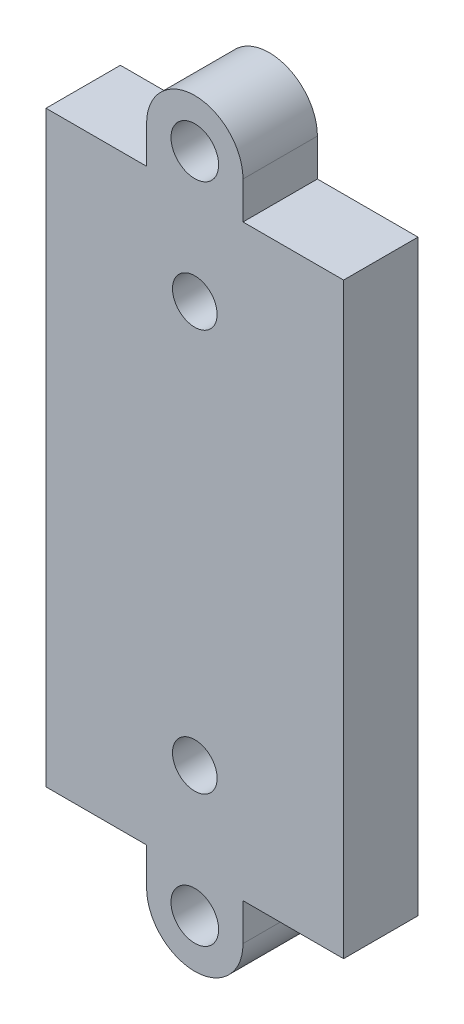
from build123d import *

# Parameters (mm, degrees)
ESQUISSE1_R             = 1
ESQUISSE1_R_2           = 1.5
BOSS_EXTRU_1_DEPTH      = 5
ENL_V_MAT_EXTRU_1_DEPTH = 5
ESQUISSE3_W             = 20
ESQUISSE3_H             = 34
BOSS_EXTRU_2_DEPTH      = 5
ESQUISSE4_R             = 1.5
ESQUISSE4_W             = 9.798464728
ESQUISSE4_H             = 39.858161606
ENL_V_MAT_EXTRU_2_DEPTH = 5
ESQUISSE5_W             = 2.5
ESQUISSE5_H             = 34
BOSS_EXTRU_3_DEPTH      = 5
ESQUISSE6_R             = 1.6
BOSS_EXTRU_4_DEPTH      = 5
CONG_1_R                = 10
ESQUISSE7_W             = 40.251504125
ESQUISSE7_H             = 45.079075122
ENL_V_MAT_EXTRU_3_DEPTH = 10
ESQUISSE8_W             = 20
ESQUISSE8_H             = 39.5
ESQUISSE8_R             = 1.5
BOSS_EXTRU_5_DEPTH      = 5
ESQUISSE9_R             = 1.6
BOSS_EXTRU_6_DEPTH      = 5
ESQUISSE10_R            = 1.5
ENL_V_MAT_EXTRU_4_DEPTH = 10
ESQUISSE11_R            = 1.5
ENL_V_MAT_EXTRU_5_DEPTH = 10
BOSS_EXTRU_7_DEPTH      = 5


with BuildPart() as part:
    # Esquisse1 → Boss.-Extru.1 (new body)
    with BuildSketch(Plane.XY):
        with BuildLine():
            Line((-13.584596858, -30.047129187), (-13.584596858, -25.547129187))
            Line((-13.584596858, -25.547129187), (-13.584596858, -25.297129187))
            Line((-13.584596858, -25.297129187), (-13.834596858, -25.297129187))
            Line((-13.834596858, -25.297129187), (-16.334596858, -25.297129187))
            Line((-16.334596858, -25.297129187), (-16.584596858, -25.297129187))
            Line((-16.584596858, -25.297129187), (-16.584596858, -25.047129187))
            Line((-16.584596858, -25.047129187), (-16.584596858, 6.452870813))
            Line((-16.584596858, 6.452870813), (-16.584596858, 6.702870813))
            Line((-16.584596858, 6.702870813), (-16.334596858, 6.702870813))
            Line((-16.334596858, 6.702870813), (-13.834596858, 6.702870813))
            Line((-13.834596858, 6.702870813), (-13.584596858, 6.702870813))
            Line((-13.584596858, 6.702870813), (-13.584596858, 6.952870813))
            Line((-13.584596858, 6.952870813), (-13.584596858, 11.452870813))
            Line((-13.584596858, 11.452870813), (-13.584596858, 11.702870813))
            Line((-13.584596858, 11.702870813), (-13.334596858, 11.702870813))
            Line((-13.334596858, 11.702870813), (-8.584596858, 11.702870813))
            Line((-8.584596858, 11.702870813), (-8.584596858, 6.702870813))
            Line((-8.584596858, 6.702870813), (-7.491776281, 6.702870813))
            Line((-7.491776281, 6.702870813), (-4.034541178, 6.702870813))
            ThreePointArc((-4.034541178, 6.702870813), (-0.161557832, 6.19424756), (3.448773595, 4.702870813))
            ThreePointArc((3.448773595, 4.702870813), (10.66943645, 1.720117321), (18.415403142, 0.702870813))
            ThreePointArc((18.415403142, 0.702870813), (28.415403142, -9.297129187), (18.415403142, -19.297129187))
            ThreePointArc((18.415403142, -19.297129187), (10.66943645, -20.314375694), (3.448773595, -23.297129187))
            ThreePointArc((3.448773595, -23.297129187), (-0.161557832, -24.788505933), (-4.034541178, -25.297129187))
            Line((-4.034541178, -25.297129187), (-7.491776281, -25.297129187))
            Line((-7.491776281, -25.297129187), (-8.584596858, -25.297129187))
            Line((-8.584596858, -25.297129187), (-8.584596858, -30.297129187))
            Line((-8.584596858, -30.297129187), (-13.334596858, -30.297129187))
            Line((-13.334596858, -30.297129187), (-13.584596858, -30.297129187))
            Line((-13.584596858, -30.297129187), (-13.584596858, -30.047129187))
        make_face()
        with Locations((18.477857718, -2.297129187)):
            Circle(ESQUISSE1_R, mode=Mode.SUBTRACT)
        with Locations((25.415403142, -9.359583762)):
            Circle(ESQUISSE1_R, mode=Mode.SUBTRACT)
        with Locations((18.415403142, -9.297129187)):
            Circle(ESQUISSE1_R_2, mode=Mode.SUBTRACT)
        with Locations((11.415403142, -9.234674611)):
            Circle(ESQUISSE1_R, mode=Mode.SUBTRACT)
        with Locations((18.352948567, -16.297129187)):
            Circle(ESQUISSE1_R, mode=Mode.SUBTRACT)
    extrude(amount=BOSS_EXTRU_1_DEPTH)

    # Esquisse2 → Enlèv. mat.-Extru.1 (cut)
    with BuildSketch(Plane(origin=(0, 0, 0), x_dir=(-1, 0, 0), z_dir=(0, 0, -1))):
        Polygon((1.584596858, -19.297129187), (1.584596858, -25.297129187), (1.584596858, -26.297129187), (21.584596858, -26.297129187), (21.584596858, -33.65697819), (-26.833247513, -33.65697819), (-26.198667142, -19.297129187), align=None)
        Polygon((21.584596858, 7.702870813), (1.584596858, 7.702870813), (1.584596858, 6.702870813), (1.584596858, 0.702870813), (-26.198667142, 0.702870813), (-26.833247513, 15.062719816), (21.584596858, 15.062719816), align=None)
    extrude(amount=-ENL_V_MAT_EXTRU_1_DEPTH, mode=Mode.SUBTRACT)

    # Esquisse3 → Boss.-Extru.2 (add)
    with BuildSketch(Plane(origin=(0, 0, 0), x_dir=(-1, 0, 0), z_dir=(0, 0, -1))):
        with Locations((11.584596858, -9.297129187)):
            Rectangle(ESQUISSE3_W, ESQUISSE3_H)
    extrude(amount=-BOSS_EXTRU_2_DEPTH)

    # Esquisse4 → Enlèv. mat.-Extru.2 (cut)
    with BuildSketch(Plane(origin=(0, 0, 0), x_dir=(-1, 0, 0), z_dir=(0, 0, -1))):
        with Locations((9.084596858, -22.797129187)):
            Circle(ESQUISSE4_R)
        with Locations((9.084596858, 4.202870813)):
            Circle(ESQUISSE4_R)
        with Locations((23.983829222, -9.020336398)):
            Rectangle(ESQUISSE4_W, ESQUISSE4_H)
    extrude(amount=-ENL_V_MAT_EXTRU_2_DEPTH, mode=Mode.SUBTRACT)

    # Esquisse5 → Boss.-Extru.3 (add)
    with BuildSketch(Plane(origin=(0, 0, 0), x_dir=(-1, 0, 0), z_dir=(0, 0, -1))):
        with Locations((0.334596858, -9.297129187)):
            Rectangle(ESQUISSE5_W, ESQUISSE5_H)
    extrude(amount=-BOSS_EXTRU_3_DEPTH)

    # Esquisse6 → Boss.-Extru.4 (add)
    # profile 1 of 2: a face of its own
    with BuildSketch(Plane(origin=(0, 0, 0), x_dir=(-1, 0, 0), z_dir=(0, 0, -1))):
        with BuildLine():
            Line((12.324596858, -25.12480516), (5.844596858, -25.12480516))
            Line((5.844596858, -25.12480516), (5.844596858, -28.797129187))
            ThreePointArc((5.844596858, -28.797129187), (9.084596858, -32.037129187), (12.324596858, -28.797129187))
            Line((12.324596858, -28.797129187), (12.324596858, -25.12480516))
        make_face()
        with Locations((9.084596858, -28.797129187)):
            Circle(ESQUISSE6_R, mode=Mode.SUBTRACT)
    # profile 2 of 2: a face of its own
    with BuildSketch(Plane(origin=(0, 0, 0), x_dir=(-1, 0, 0), z_dir=(0, 0, -1))):
        with BuildLine():
            Line((12.324596858, 6.757738308), (5.844596858, 6.757738308))
            Line((5.844596858, 6.757738308), (5.844596858, 10.202870813))
            ThreePointArc((5.844596858, 10.202870813), (9.084596858, 13.442870813), (12.324596858, 10.202870813))
            Line((12.324596858, 10.202870813), (12.324596858, 6.757738308))
        make_face()
        with Locations((9.084596858, 10.202870813)):
            Circle(ESQUISSE6_R, mode=Mode.SUBTRACT)
    extrude(amount=-BOSS_EXTRU_4_DEPTH)

    # Congé1
    # the kernel refuses this fillet: 10 mm, written as the material it adds along each edge
    with BuildSketch(Plane(origin=(0.915403142, 0.702870813, 0), x_dir=(1, 0, 0), z_dir=(0, 0, 1))) as cong_1_piece_1:
        with BuildLine():
            CenterArc((9.539392014, 10), CONG_1_R, 197.457603124, 72.542396876)
            Line((0, 7), (-0.19078784, 6.94))
            ThreePointArc((-0.19078784, 6.94), (-0.2, 3.5), (-0.2, 0))
            Line((-0.2, 0), (0, -0.2))
            Line((0, -0.2), (9.539392014, -0.2))
            Line((9.539392014, -0.2), (9.539392014, 0))
        make_face()
    extrude(amount=5)
    with BuildSketch(Plane(origin=(0.915403142, -19.297129187, 5), x_dir=(0, -1, 0), z_dir=(0, 0, -1))) as cong_1_piece_2:
        with BuildLine():
            CenterArc((10, -9.539392014), CONG_1_R, 107.457603124, 72.542396876)
            Line((0, -9.539392014), (-0.2, -9.539392014))
            Line((-0.2, -9.539392014), (-0.2, 0))
            Line((-0.2, 0), (0, 0.2))
            ThreePointArc((0, 0.2), (3.5, 0.2), (6.94, 0.19078784))
            Line((6.94, 0.19078784), (7, 0))
        make_face()
    extrude(amount=5)

    # Esquisse7 → Enlèv. mat.-Extru.3 (cut)
    with BuildSketch(Plane(origin=(0, 0, 0), x_dir=(-1, 0, 0), z_dir=(0, 0, -1))):
        with Locations((-21.041155205, -11.091158949)):
            Rectangle(ESQUISSE7_W, ESQUISSE7_H)
    extrude(amount=-ENL_V_MAT_EXTRU_3_DEPTH, mode=Mode.SUBTRACT)

    # Esquisse8 → Boss.-Extru.5 (add)
    with BuildSketch(Plane(origin=(0, 0, 0), x_dir=(-1, 0, 0), z_dir=(0, 0, -1))):
        with Locations((9.084596858, -6.547129187)):
            Rectangle(ESQUISSE8_W, ESQUISSE8_H)
        with Locations((9.084596858, -22.797129187)):
            Circle(ESQUISSE8_R, mode=Mode.SUBTRACT)
    extrude(amount=-BOSS_EXTRU_5_DEPTH)

    # Esquisse9 → Boss.-Extru.6 (add)
    with BuildSketch(Plane(origin=(0, 0, 0), x_dir=(-1, 0, 0), z_dir=(0, 0, -1))):
        with BuildLine():
            Line((12.324596858, 15.702870813), (12.324596858, 13.202870813))
            Line((12.324596858, 13.202870813), (10.308361541, 13.202870813))
            ThreePointArc((10.308361541, 13.202870813), (9.084596858, 13.442870813), (7.860832174, 13.202870813))
            Line((7.860832174, 13.202870813), (5.844596858, 13.202870813))
            Line((5.844596858, 13.202870813), (5.844596858, 15.702870813))
            ThreePointArc((5.844596858, 15.702870813), (9.084596858, 18.942870813), (12.324596858, 15.702870813))
        make_face()
        with Locations(Location((9.084596858, 15.702870813, 0), (0, 0, 180))):
            Circle(ESQUISSE9_R, mode=Mode.SUBTRACT)
    extrude(amount=-BOSS_EXTRU_6_DEPTH)

    # Esquisse10 → Enlèv. mat.-Extru.4 (cut)
    with BuildSketch(Plane(origin=(0, 0, 0), x_dir=(-1, 0, 0), z_dir=(0, 0, -1))):
        with Locations(Location((9.084596858, 9.702870813, 0), (0, 0, 180))):
            Circle(ESQUISSE10_R)
    extrude(amount=-ENL_V_MAT_EXTRU_4_DEPTH, mode=Mode.SUBTRACT)

    # Esquisse11 → Enlèv. mat.-Extru.5 (cut)
    with BuildSketch(Plane(origin=(0, 0, 0), x_dir=(-1, 0, 0), z_dir=(0, 0, -1))):
        with Locations((9.084596858, -20.047129187)):
            Circle(ESQUISSE11_R)
        with Locations((9.084596858, 6.952870813)):
            Circle(ESQUISSE11_R)
    extrude(amount=-ENL_V_MAT_EXTRU_5_DEPTH, mode=Mode.SUBTRACT)

    # Esquisse12 → Boss.-Extru.7 (add)
    with BuildSketch(Plane(origin=(0, 0, 0), x_dir=(-1, 0, 0), z_dir=(0, 0, -1))):
        with BuildLine():
            ThreePointArc((9.684075798, 8.327870813), (9.084596858, 11.202870813), (8.485117917, 8.327870813))
            ThreePointArc((8.485117917, 8.327870813), (9.084596858, 8.452870813), (9.684075798, 8.327870813))
        make_face()
        with BuildLine():
            ThreePointArc((8.485117917, -21.422129187), (9.084596858, -24.297129187), (9.684075798, -21.422129187))
            ThreePointArc((9.684075798, -21.422129187), (9.084596858, -21.547129187), (8.485117917, -21.422129187))
        make_face()
    extrude(amount=-BOSS_EXTRU_7_DEPTH)


solid = part.part
